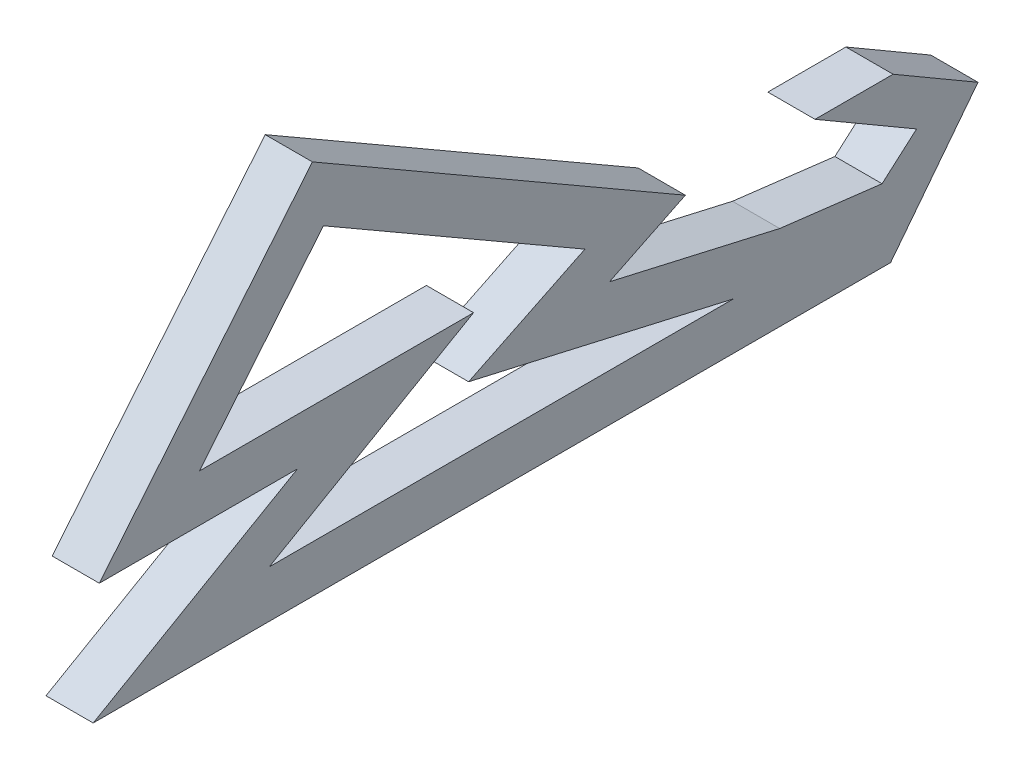
from build123d import *

# Parameters (mm, degrees)
BOSS_EXTRUDE1_DEPTH = 10


with BuildPart() as part:
    # Sketch1 → Boss-Extrude1 (new body)
    with BuildSketch(Plane(origin=(0, 0, 0), x_dir=(0, 0, -1), z_dir=(1, 0, 0))):
        Polygon((-84.5, 0), (84.5, 0), (103.022719545, 23.837300471), (85.030260907, 34.310612808), (68.481056011, 34.310612808), (90.006488303, 21.780775717), (82.690523765, 15.385421213), (60.999669369, 18.014714385), (24.911453349, 26.273949517), (41.001886779, 34.121778265), (-38.040852581, 79.757125112), (-83.198729811, 25), (-41.198729811, 25), align=None)
        Polygon((19.714317813, 34.865156554), (-4.930462726, 22.845093947), (51.195379163, 10), (-47.179491924, 10), (-3.878221735, 35), (-61.989843363, 35), (-35.710989078, 66.864972407), align=None, mode=Mode.SUBTRACT)
    extrude(amount=BOSS_EXTRUDE1_DEPTH)


solid = part.part
